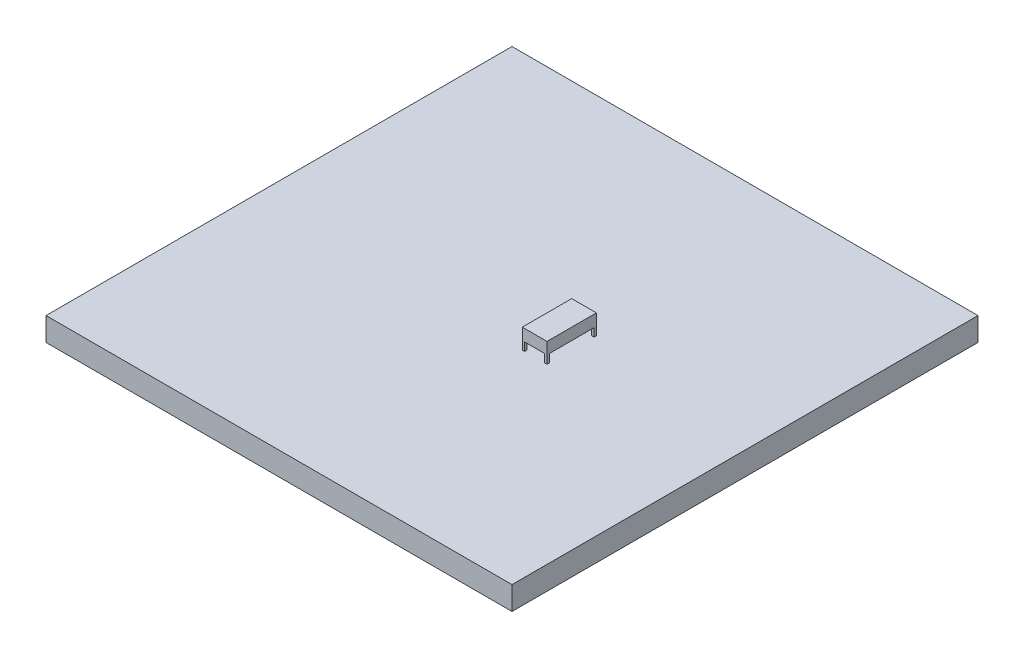
from build123d import *

# Parameters (mm, degrees)
SKETCH2_W           = 20000
SKETCH2_H           = 20000
BOSS_EXTRUDE1_DEPTH = 1000
SKETCH6_W           = 1060.125212232
SKETCH6_H           = 2120.250424464
BOSS_EXTRUDE2_DEPTH = 500
BOSS_EXTRUDE3_REACH = 14208.425
SKETCH8_W           = 104.494572357
SKETCH8_H           = 101.56933371
SKETCH8_W_2         = 102.262075999
SKETCH8_H_2         = 97.319419979


with BuildPart() as part:
    # Sketch2 → Boss-Extrude1 (new body)
    with BuildSketch(Plane(origin=(0, 0, 0), x_dir=(1, 0, 0), z_dir=(0, 1, 0))):
        Rectangle(SKETCH2_W, SKETCH2_H)
    extrude(amount=-BOSS_EXTRUDE1_DEPTH)

    # Sketch8 → Boss-Extrude3 (add, up to next)
    with BuildSketch(Plane.XZ.offset(-350), mode=Mode.PRIVATE) as boss_extrude3_sk1:
        with Locations((1554.091336841, 1009.340545377)):
            Rectangle(SKETCH8_W, SKETCH8_H)
    boss_extrude3_tool1 = extrude(boss_extrude3_sk1.sketch, amount=BOSS_EXTRUDE3_REACH, mode=Mode.PRIVATE) - part.part
    # Sketch8 → Boss-Extrude3 (add, up to next)
    with BuildSketch(Plane.XZ.offset(-350), mode=Mode.PRIVATE) as boss_extrude3_sk2:
        with Locations((2510.838224894, 1009.340545377)):
            Rectangle(SKETCH8_W_2, SKETCH8_H)
    boss_extrude3_tool2 = extrude(boss_extrude3_sk2.sketch, amount=BOSS_EXTRUDE3_REACH, mode=Mode.PRIVATE) - part.part
    # Sketch8 → Boss-Extrude3 (add, up to next)
    with BuildSketch(Plane.XZ.offset(-350), mode=Mode.PRIVATE) as boss_extrude3_sk3:
        with Locations((2510.838224894, -1011.465502242)):
            Rectangle(SKETCH8_W_2, SKETCH8_H_2)
    boss_extrude3_tool3 = extrude(boss_extrude3_sk3.sketch, amount=BOSS_EXTRUDE3_REACH, mode=Mode.PRIVATE) - part.part
    # Sketch8 → Boss-Extrude3 (add, up to next)
    with BuildSketch(Plane.XZ.offset(-350), mode=Mode.PRIVATE) as boss_extrude3_sk4:
        with Locations((1554.091336841, -1011.465502242)):
            Rectangle(SKETCH8_W, SKETCH8_H_2)
    boss_extrude3_tool4 = extrude(boss_extrude3_sk4.sketch, amount=BOSS_EXTRUDE3_REACH, mode=Mode.PRIVATE) - part.part


with BuildPart() as body_2:
    # Sketch6 → Boss-Extrude2 (new body)
    with BuildSketch(Plane(origin=(0, 350, 0), x_dir=(1, 0, 0), z_dir=(0, 1, 0))):
        with Locations((2031.906656778, 0)):
            Rectangle(SKETCH6_W, SKETCH6_H)
    extrude(amount=BOSS_EXTRUDE2_DEPTH)


with BuildPart() as part_1:
    add(part.part)

    add(body_2.part)  # Boss-Extrude3 merges body 2
    add(boss_extrude3_tool1.solids().sort_by_distance((1554.091337, 350, 1009.340545))[0])
    add(boss_extrude3_tool2.solids().sort_by_distance((2510.838225, 350, 1009.340545))[0])
    add(boss_extrude3_tool3.solids().sort_by_distance((2510.838225, 350, -1011.465502))[0])
    add(boss_extrude3_tool4.solids().sort_by_distance((1554.091337, 350, -1011.465502))[0])


solid = part_1.part
